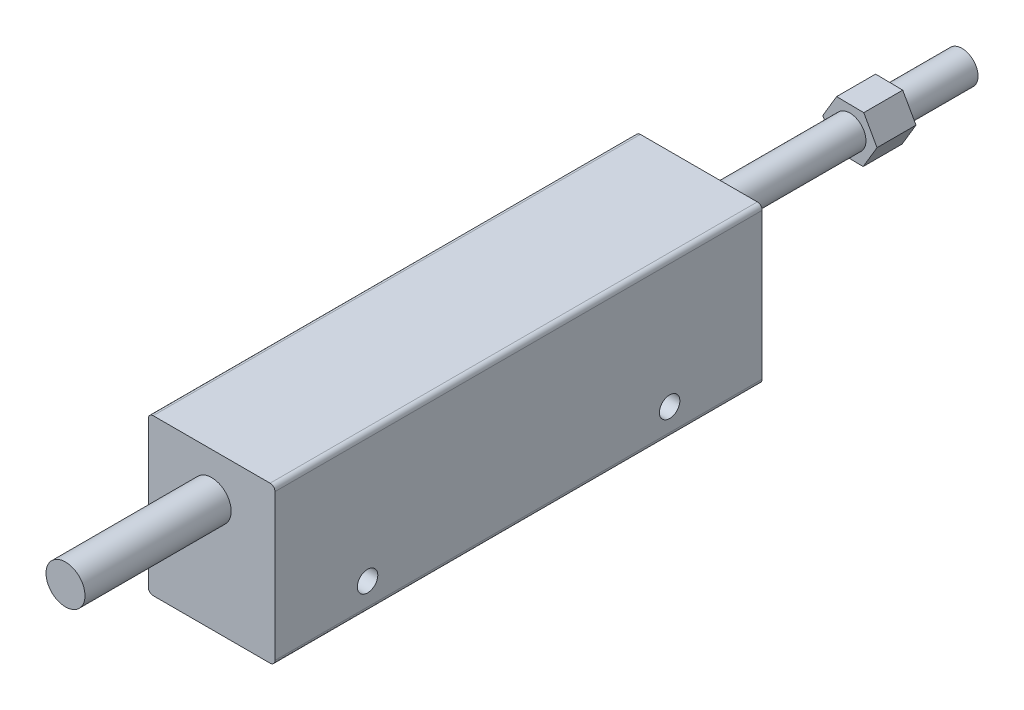
from build123d import *

# Parameters (mm, degrees)
SKETCH1_W           = 13
SKETCH1_H           = 16
BOSS_EXTRUDE1_DEPTH = 50
SKETCH2_R           = 1.05
CUT_EXTRUDE1_DEPTH  = 55.083269132
SKETCH3_R           = 2
BOSS_EXTRUDE2_DEPTH = 15
SKETCH4_R           = 1.65
BOSS_EXTRUDE3_DEPTH = 27
FILLET1_R           = 0.5
BOSS_EXTRUDE4_START = -7.5
BOSS_EXTRUDE4_DEPTH = 4


with BuildPart() as part:
    # Sketch1 → Boss-Extrude1 (new body)
    with BuildSketch(Plane.XY):
        with Locations((6.5, 8)):
            Rectangle(SKETCH1_W, SKETCH1_H)
    extrude(amount=BOSS_EXTRUDE1_DEPTH)

    # Sketch2 → Cut-Extrude1 (cut, through all)
    with BuildSketch(Plane(origin=(13, 0, 0), x_dir=(0, 0, -1), z_dir=(1, 0, 0))):
        with Locations((-40.5, 2.8)):
            Circle(SKETCH2_R)
        with Locations((-9.5, 2.8)):
            Circle(SKETCH2_R)
    extrude(amount=-CUT_EXTRUDE1_DEPTH, mode=Mode.SUBTRACT)

    # Sketch3 → Boss-Extrude2 (add)
    with BuildSketch(Plane.XY.offset(50)):
        with Locations((6.5, 11.5)):
            Circle(SKETCH3_R)
    extrude(amount=BOSS_EXTRUDE2_DEPTH)

    # Sketch4 → Boss-Extrude3 (add)
    with BuildSketch(Plane(origin=(0, 0, 0), x_dir=(-1, 0, 0), z_dir=(0, 0, -1))):
        with Locations((-6.5, 11.5)):
            Circle(SKETCH4_R)
    extrude(amount=BOSS_EXTRUDE3_DEPTH)

    # Fillet1
    fillet1_edges = [part.edges().sort_by_distance(p)[0] for p in [
        (13, 0, 25),
        (0, 0, 25),
        (13, 16, 25),
        (0, 16, 25),
    ]]
    fillet(fillet1_edges, radius=FILLET1_R)

    # Sketch6 → Boss-Extrude4 (add)
    with BuildSketch(Plane(origin=(0, 0, -27), x_dir=(-1, 0, 0), z_dir=(0, 0, -1)).offset(BOSS_EXTRUDE4_START)):
        Polygon((-7.86221417, 9.070311134), (-5.076934804, 9.10544349), (-3.714720633, 11.535132356), (-5.13778583, 13.929688866), (-7.923065196, 13.89455651), (-9.285279367, 11.464867644), align=None)
    extrude(amount=-BOSS_EXTRUDE4_DEPTH)


solid = part.part
